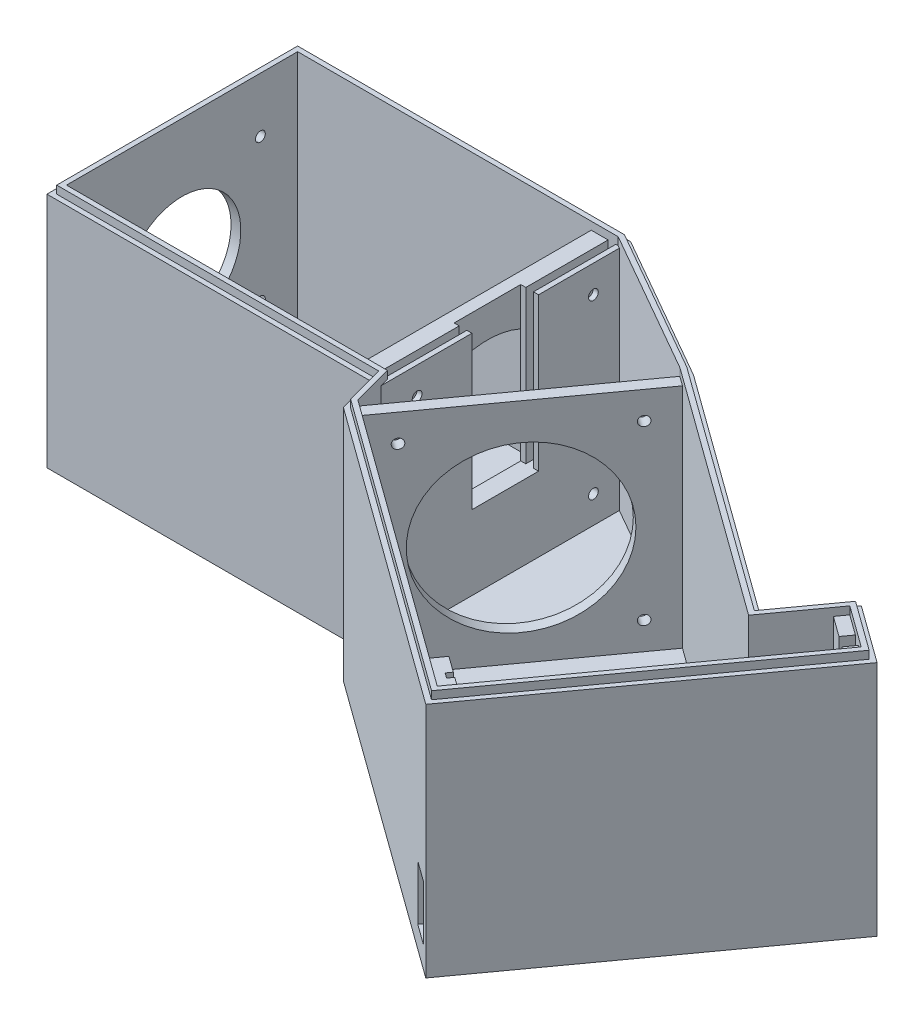
from build123d import *

# Parameters (mm, degrees)
EXTRUDE_1_DEPTH                 = 60.5
SHELL_1_T                       = -2.5
EXTRUDE_3_DEPTH                 = 4.55
CUT_EXTRUDE_1_REACH             = 237.14
SKETCH_7_W                      = 1.95
SKETCH_7_H                      = 39
CUT_EXTRUDE_1_DIRECTION_2_REACH = 237.14
SKETCH_8_W                      = 59
SKETCH_8_H                      = 58
SKETCH_8_R                      = 21
EXTRUDE_5_DEPTH                 = 3
HOLE_START                      = 77.45
HOLE_WIZARD_M3_1_OUTLINE_R      = 1.25
HOLE_WIZARD_M3_1_DEPTH          = 7.55
PATTERN_LINEAR_1_COUNT          = 2
PATTERN_LINEAR_1_PITCH          = 45
PATTERN_LINEAR_1_COUNT_DIR2     = 2
PATTERN_LINEAR_1_PITCH_DIR2     = 44
SKETCH_13_W                     = 64
SKETCH_13_H                     = 60.5
SKETCH_13_R                     = 21
EXTRUDE_6_DEPTH                 = 3
HOLE_WIZARD_M3_2_REACH          = 146.84
HOLE_WIZARD_M3_2_BORE_R         = 1.25
PATTERN_LINEAR_2_COUNT          = 2
PATTERN_LINEAR_2_PITCH          = 45
PATTERN_LINEAR_2_COUNT_DIR2     = 2
PATTERN_LINEAR_2_PITCH_DIR2     = 44
CUT_EXTRUDE_2_REACH             = 240.449
SKETCH_16_R                     = 15
HOLE_WIZARD_M3_3_REACH          = 240.449
HOLE_WIZARD_M3_3_BORE_R         = 1.25
PATTERN_LINEAR_3_COUNT          = 2
PATTERN_LINEAR_3_PITCH          = 40
PATTERN_LINEAR_3_COUNT_DIR2     = 2
PATTERN_LINEAR_3_PITCH_DIR2     = 36.5
EXTRUDE_7_DEPTH                 = 58
CUT_EXTRUDE_4_DEPTH             = 12
CUT_EXTRUDE_5_REACH             = 237.925
SKETCH_22_W                     = 6.65
SKETCH_22_H                     = 14
EXTRUDE_8_DEPTH                 = 2


# Read off the part's stored shape, not the designer's step: M3 螺纹孔1
with BuildPart() as part:
    # 草图2 → 凸台-拉伸1 (new body)
    with BuildSketch(Plane(origin=(0, 0, 0), x_dir=(1, 0, 0), z_dir=(0, 1, 0))):
        Polygon((0, -32), (82.5, -32), (85, -41.313840204), (161.143914202, -96.432841737), (209.519633633, -29.6044064), (194.938884105, -19.049703979), (184.090995505, -34.035474327), (122.527830831, 10.528824785), (85, 32), (0, 32), align=None)
    extrude(amount=EXTRUDE_1_DEPTH)

    # 抽壳1
    shell_1_openings = [part.faces().sort_by_distance(p)[0] for p in [
        (97.534213711, 60.5, 20.40382731),
    ]]
    offset(amount=SHELL_1_T, openings=shell_1_openings, kind=Kind.INTERSECTION)

    # 草图5 → 凸台-拉伸3 (add)
    with BuildSketch(Plane.ZY.offset(-85)):
        Polygon((-32, 60.5), (-32, 2.5), (32, 2.5), (32, 60.5), (8.5, 60.5), (8.5, 21.5), (-8.5, 21.5), (-8.5, 60.5), align=None)
    extrude(amount=EXTRUDE_3_DEPTH)

    # 切除-拉伸1: up to this face of the body (flat: up to its plane)
    cut_extrude_1_end = Plane(part.part.faces().sort_by_distance((41.475, 31.5, 29.5))[0])
    # 草图7 → 切除-拉伸1 (cut, up to the picked face)
    with BuildSketch(Plane(origin=(0, 0, 8.5), x_dir=(-1, 0, 0), z_dir=(0, 0, -1)), mode=Mode.PRIVATE) as cut_extrude_1_sk1:
        with Locations((-82.725, 41)):
            Rectangle(SKETCH_7_W, SKETCH_7_H)
    cut_extrude_1_tool1 = split(extrude(cut_extrude_1_sk1.sketch, amount=-CUT_EXTRUDE_1_REACH, mode=Mode.PRIVATE), bisect_by=cut_extrude_1_end, keep=Keep.BOTH, mode=Mode.PRIVATE)
    add(cut_extrude_1_tool1.solids().sort_by(Axis((82.725, 41, 8.5), (0, 0, 1)))[0], mode=Mode.SUBTRACT)

    # 切除-拉伸1 direction 2: up to this face of the body (flat: up to its plane)
    cut_extrude_1_direction_2_end = Plane(part.part.faces().sort_by_distance((41.475, 31.5, -29.5))[0])
    # 草图7 → 切除-拉伸1 direction 2 (cut, up to the picked face)
    with BuildSketch(Plane(origin=(0, 0, 8.5), x_dir=(-1, 0, 0), z_dir=(0, 0, -1)), mode=Mode.PRIVATE) as cut_extrude_1_direction_2_sk1:
        with Locations((-82.725, 41)):
            Rectangle(SKETCH_7_W, SKETCH_7_H)
    cut_extrude_1_direction_2_tool1 = split(extrude(cut_extrude_1_direction_2_sk1.sketch, amount=CUT_EXTRUDE_1_DIRECTION_2_REACH, mode=Mode.PRIVATE), bisect_by=cut_extrude_1_direction_2_end, keep=Keep.BOTH, mode=Mode.PRIVATE)
    add(cut_extrude_1_direction_2_tool1.solids().sort_by(Axis((82.725, 41, 8.5), (0, 0, -1)))[0], mode=Mode.SUBTRACT)

    # 草图8 → 凸台-拉伸5 (add)
    with BuildSketch(Plane.ZY.offset(-80.45)):
        with Locations((0, 31.5)):
            Rectangle(SKETCH_8_W, SKETCH_8_H)
        with Locations(Location((0, 31.5, 0), (0, 0, 113.876207731))):
            Circle(SKETCH_8_R, mode=Mode.SUBTRACT)
    extrude(amount=EXTRUDE_5_DEPTH)

    # M3 螺纹孔1 outline → M3 螺纹孔1 (cut)
    with BuildSketch(Plane.YZ.offset(HOLE_START)):
        with Locations((53.5, -22.5)):
            Circle(HOLE_WIZARD_M3_1_OUTLINE_R)
    hole_wizard_m3_1 = extrude(amount=HOLE_WIZARD_M3_1_DEPTH, mode=Mode.SUBTRACT)

    # 阵列(线性)1: Hole Wizard M3 _1 2 × 2
    with Locations(*[(0, -j * PATTERN_LINEAR_1_PITCH_DIR2, i * PATTERN_LINEAR_1_PITCH) for i in range(PATTERN_LINEAR_1_COUNT) for j in range(PATTERN_LINEAR_1_COUNT_DIR2) if (i, j) != (0, 0)]):
        add(hole_wizard_m3_1, mode=Mode.SUBTRACT)

    # 草图13 → 凸台-拉伸6 (add)
    with BuildSketch(Plane(origin=(75.397730804, 0, 54.578854835), x_dir=(0.5863723567357906, 0, -0.8100416404457952), z_dir=(0.8100416404457952, 0, 0.5863723567357906))):
        with Locations((48.375719431, 30.25)):
            Rectangle(SKETCH_13_W, SKETCH_13_H)
        with Locations((48.375719431, 30.25)):
            Circle(SKETCH_13_R, mode=Mode.SUBTRACT)
    extrude(amount=EXTRUDE_6_DEPTH)

    # M3 螺纹孔2 bore (on position points) → M3 螺纹孔2 (cut, up to next)
    with BuildSketch(Plane(origin=(93.00066231, 53.5, 35.37756169), x_dir=(-0.586372356736, 0, 0.810041640446), z_dir=(0.810041640446, 0, 0.586372356736)), mode=Mode.PRIVATE) as hole_wizard_m3_2_sk1:
        Circle(HOLE_WIZARD_M3_2_BORE_R)
    hole_wizard_m3_2_tool1 = extrude(hole_wizard_m3_2_sk1.sketch, amount=-HOLE_WIZARD_M3_2_REACH, mode=Mode.PRIVATE) & part.part
    hole_wizard_m3_2 = hole_wizard_m3_2_tool1.solids().sort_by_distance((93.000662, 53.5, 35.377562))[0]
    add(hole_wizard_m3_2, mode=Mode.SUBTRACT)

    # 阵列(线性)2: Hole Wizard M3 _2 2 × 2
    with Locations(*[Vector(0.5863723567357906, 0, -0.8100416404457951) * (i * PATTERN_LINEAR_2_PITCH) + Vector(0, -1, 0) * (j * PATTERN_LINEAR_2_PITCH_DIR2) for i in range(PATTERN_LINEAR_2_COUNT) for j in range(PATTERN_LINEAR_2_COUNT_DIR2) if (i, j) != (0, 0)]):
        add(hole_wizard_m3_2, mode=Mode.SUBTRACT)

    # 草图16 → 切除-拉伸2 (cut, up to next)
    with BuildSketch(Plane.ZY, mode=Mode.PRIVATE) as cut_extrude_2_sk1:
        with Locations((0, 30.25)):
            Circle(SKETCH_16_R)
    cut_extrude_2_tool1 = extrude(cut_extrude_2_sk1.sketch, amount=-CUT_EXTRUDE_2_REACH, mode=Mode.PRIVATE) & part.part
    add(cut_extrude_2_tool1.solids().sort_by_distance((0, 30.25, 0))[0], mode=Mode.SUBTRACT)

    # M3 螺纹孔3 bore → M3 螺纹孔3 (cut, up to next)
    with BuildSketch(Plane.ZY, mode=Mode.PRIVATE) as hole_wizard_m3_3_sk1:
        with Locations((-20, 48.5)):
            Circle(HOLE_WIZARD_M3_3_BORE_R)
    hole_wizard_m3_3_tool1 = extrude(hole_wizard_m3_3_sk1.sketch, amount=-HOLE_WIZARD_M3_3_REACH, mode=Mode.PRIVATE) & part.part
    hole_wizard_m3_3 = hole_wizard_m3_3_tool1.solids().sort_by_distance((0, 48.5, -20))[0]
    add(hole_wizard_m3_3, mode=Mode.SUBTRACT)

    # 阵列(线性)3: Hole Wizard M3 _3 2 × 2
    with Locations(*[(0, -j * PATTERN_LINEAR_3_PITCH_DIR2, i * PATTERN_LINEAR_3_PITCH) for i in range(PATTERN_LINEAR_3_COUNT) for j in range(PATTERN_LINEAR_3_COUNT_DIR2) if (i, j) != (0, 0)]):
        add(hole_wizard_m3_3, mode=Mode.SUBTRACT)

    # 草图19 → 凸台-拉伸7 (add)
    with BuildSketch(Plane(origin=(0, 2.5, 0), x_dir=(1, 0, 0), z_dir=(0, 1, 0))):
        Polygon((153.493245308, -82.870402226), (151.147755881, -86.110568788), (160.584740993, -92.941806744), (162.93023042, -89.701640182), (158.880022217, -86.769778399), (158.000463682, -87.984840859), (156.663894976, -87.017326471), (157.543453511, -85.80226401), align=None)
        Polygon((206.02859864, -30.16357961), (201.978390437, -27.231717826), (200.219273367, -29.661842747), (204.269481569, -32.593704531), align=None)
        Polygon((195.498057314, -22.540738972), (200.641821731, -26.264203437), (198.88270466, -28.694328359), (193.738940244, -24.970863893), align=None)
    extrude(amount=EXTRUDE_7_DEPTH)

    # 草图21 → 切除-拉伸4 (cut)
    with BuildSketch(Plane(origin=(0, 60.5, 0), x_dir=(1, 0, 0), z_dir=(0, 1, 0))):
        Polygon((200.219273367, -29.661842747), (201.978390437, -27.231717826), (203.314959144, -28.199232214), (201.555842074, -30.629357136), align=None)
    extrude(amount=-CUT_EXTRUDE_4_DEPTH, mode=Mode.SUBTRACT)

    # 草图22 → 切除-拉伸5 (cut, up to next)
    with BuildSketch(Plane(origin=(9.602269196, 0, -13.265014631), x_dir=(0.810041640445795, 0, 0.5863723567357908), z_dir=(-0.5863723567357908, 0, 0.810041640445795)), mode=Mode.PRIVATE) as cut_extrude_5_sk1:
        with Locations((181.253833284, 12.5)):
            Rectangle(SKETCH_22_W, SKETCH_22_H)
    cut_extrude_5_tool1 = extrude(cut_extrude_5_sk1.sketch, amount=-CUT_EXTRUDE_5_REACH, mode=Mode.PRIVATE) & part.part
    add(cut_extrude_5_tool1.solids().sort_by_distance((156.425422, 12.5, 93.017223))[0], mode=Mode.SUBTRACT)

    # 草图23 → 凸台-拉伸8 (add)
    with BuildSketch(Plane(origin=(0, 60.5, 0), x_dir=(1, 0, 0), z_dir=(0, 1, 0))):
        Polygon((1.25, 30.75), (1.25, -30.75), (83.458724754, -30.75), (86.092274477, -40.561384515), (160.864327597, -94.687324241), (207.774116136, -29.883993005), (195.218470709, -20.795221475), (184.37058211, -35.780991824), (121.849033271, 9.477061724), (84.667685679, 30.75), align=None)
        Polygon((2.5, 29.5), (2.5, -29.5), (84.417449509, -29.5), (87.184548954, -39.808928826), (160.584740993, -92.941806744), (206.02859864, -30.16357961), (195.498057314, -22.540738972), (184.650168714, -37.52650932), (121.170235712, 8.425298663), (84.335371357, 29.5), align=None, mode=Mode.SUBTRACT)
    extrude(amount=EXTRUDE_8_DEPTH)


solid = part.part
